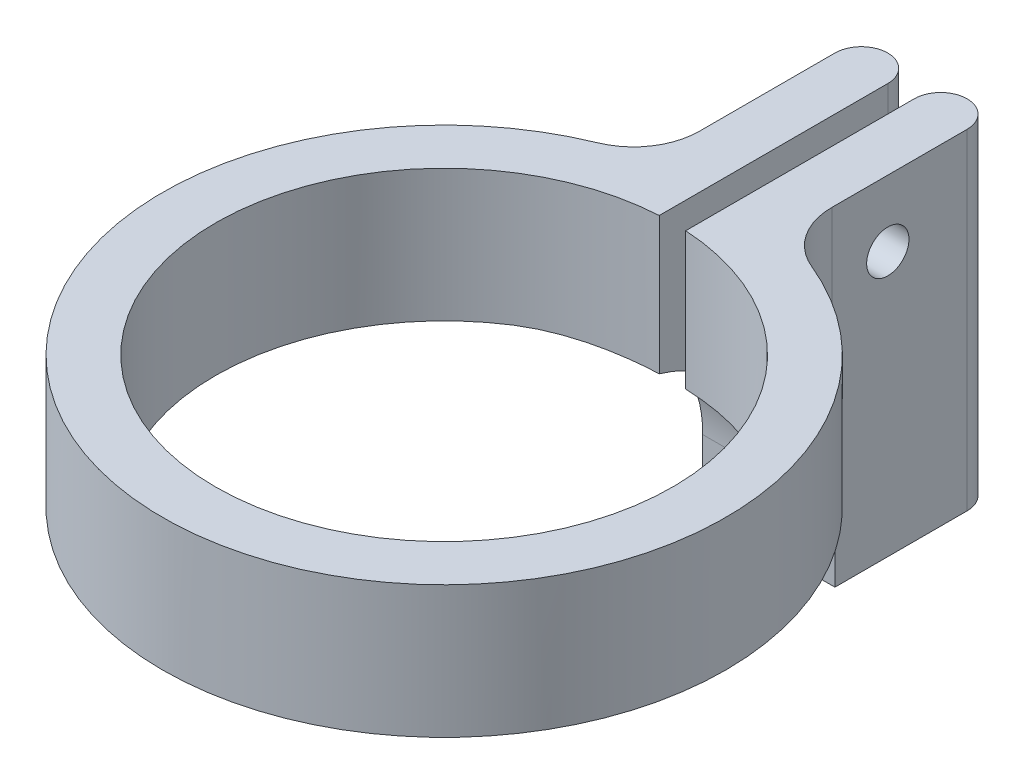
from build123d import *

# Parameters (mm, degrees)
BOSS_EXTRUDE4_DEPTH = 10
SKETCH6_R           = 1.6
CUT_EXTRUDE2_DEPTH  = 47.135107158
FILLET4_R           = 5
SKETCH7_W           = 4
SKETCH7_H           = 12
BOSS_EXTRUDE5_DEPTH = 15
FILLET5_START       = -10.0000001
FILLET5_DEPTH       = 10.0000001
FILLET5_START_2     = -22
FILLET5_2_DEPTH     = 44
FILLET6_R           = 2


with BuildPart() as part:
    # Sketch5 → Boss-Extrude4 (new body)
    with BuildSketch(Plane(origin=(0, 0, 0), x_dir=(1, 0, 0), z_dir=(0, 1, 0))):
        with BuildLine():
            ThreePointArc((17.3, 0), (-10.314795199, -13.888664443), (-5, 16.561702811))
            Line((-5, 16.561702811), (-5, 20.704830354))
            ThreePointArc((-5, 20.704830354), (-13.17554553, -16.736038958), (21.3, 0))
            ThreePointArc((21.3, 0), (16.736038958, 13.17554553), (5, 20.704830354))
            Line((5, 20.704830354), (5, 16.561702811))
            ThreePointArc((5, 16.561702811), (13.888664443, 10.314795199), (17.3, 0))
        make_face()
        with BuildLine():
            ThreePointArc((-5, 20.704830354), (-3.013586771, 21.085736761), (-1, 21.276512872))
            Line((-1, 21.276512872), (-1, 36.561702811))
            Line((-1, 36.561702811), (-5, 36.561702811))
            Line((-5, 36.561702811), (-5, 20.704830354))
        make_face()
        with BuildLine():
            ThreePointArc((-5, 16.561702811), (-3.020894222, 17.034206706), (-1, 17.271074084))
            Line((-1, 17.271074084), (-1, 21.276512872))
            ThreePointArc((-1, 21.276512872), (-3.013586771, 21.085736761), (-5, 20.704830354))
            Line((-5, 20.704830354), (-5, 16.561702811))
        make_face()
        with BuildLine():
            Line((1, 21.276512872), (1, 17.271074084))
            ThreePointArc((1, 17.271074084), (3.020894222, 17.034206706), (5, 16.561702811))
            Line((5, 16.561702811), (5, 20.704830354))
            ThreePointArc((5, 20.704830354), (3.013586771, 21.085736761), (1, 21.276512872))
        make_face()
        with BuildLine():
            Line((1, 36.561702811), (1, 21.276512872))
            ThreePointArc((1, 21.276512872), (3.013586771, 21.085736761), (5, 20.704830354))
            Line((5, 20.704830354), (5, 36.561702811))
            Line((5, 36.561702811), (1, 36.561702811))
        make_face()
    extrude(amount=BOSS_EXTRUDE4_DEPTH)

    # Sketch6 → Cut-Extrude2 (cut, through all)
    with BuildSketch(Plane(origin=(5, 0, 0), x_dir=(0, 0, -1), z_dir=(1, 0, 0))):
        with Locations((28.561702811, 5)):
            Circle(SKETCH6_R)
    extrude(amount=-CUT_EXTRUDE2_DEPTH, mode=Mode.SUBTRACT)

    # Fillet4
    fillet4_edges = [part.edges().sort_by_distance(p)[0] for p in [
        (5, 5, -20.704830354),
        (-5, 5, -20.704830354),
    ]]
    fillet(fillet4_edges, radius=FILLET4_R)

    # Sketch7 → Boss-Extrude5 (add)
    with BuildSketch(Plane.XZ):
        with Locations((-3, -30.561702811)):
            Rectangle(SKETCH7_W, SKETCH7_H)
        with Locations((3, -30.561702811)):
            Rectangle(SKETCH7_W, SKETCH7_H)
    extrude(amount=BOSS_EXTRUDE5_DEPTH)

    # Fillet5: read off the stored shape, not the designer's step
    # Fillet5 outline → Fillet5 (add)
    with BuildSketch(Plane(origin=(0, 0, 0), x_dir=(1, 0, 0), z_dir=(0, 1, 0)).offset(FILLET5_START)):
        with BuildLine():
            Line((-1, 17.271074084), (-1, 24.561702811))
            Line((-1, 24.561702811), (-5, 24.561702811))
            Line((-5, 24.561702811), (-5, 24.324678826))
            ThreePointArc((-5, 24.324678826), (-5.846344777, 21.541308874), (-8.098859316, 19.700215171))
            ThreePointArc((-8.098859316, 19.700215171), (0, -21.3), (8.098859316, 19.700215171))
            ThreePointArc((8.098859316, 19.700215171), (5.846344777, 21.541308874), (5, 24.324678826))
            Line((5, 24.324678826), (5, 24.561702811))
            Line((5, 24.561702811), (1, 24.561702811))
            Line((1, 24.561702811), (1, 17.271074084))
            ThreePointArc((1, 17.271074084), (0, -17.3), (-1, 17.271074084))
        make_face()
    extrude(amount=FILLET5_DEPTH)

    # Fillet5 2 outline → Fillet5 2 (cut)
    with BuildSketch(Plane.YZ.offset(FILLET5_START_2)):
        with BuildLine():
            ThreePointArc((-10, -24.561702811), (-2.928932188, -21.632770623), (0, -14.561702811))
            Line((0, -14.561702811), (0, 23))
            Line((0, 23), (-10.0000001, 23))
            Line((-10.0000001, 23), (-10, -24.561702811))
        make_face()
    extrude(amount=FILLET5_2_DEPTH, mode=Mode.SUBTRACT)

    # Fillet6
    fillet6_edges = [part.edges().sort_by_distance(p)[0] for p in [
        (5, -2.5, -36.561702811),
        (1, -2.5, -36.561702811),
        (-1, -2.5, -36.561702811),
        (-5, -2.5, -36.561702811),
    ]]
    fillet(fillet6_edges, radius=FILLET6_R - 0.0001)  # a hair under: the kernel refuses the full size


solid = part.part
